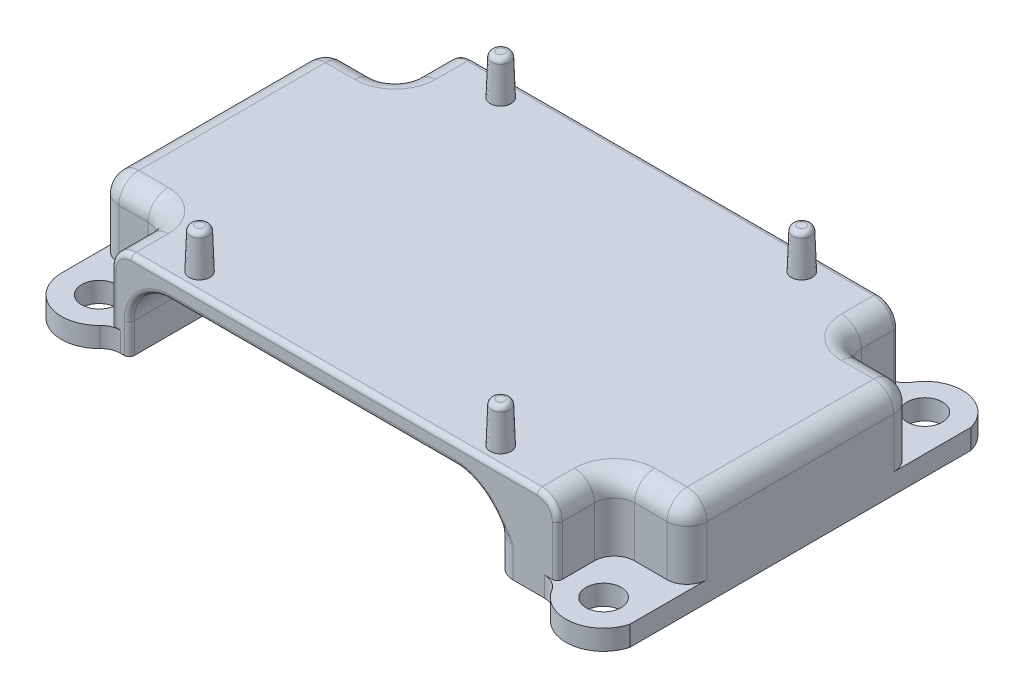
from build123d import *

# Parameters (mm, degrees)
SKETCH1_R             = 1.75
BOSS_EXTRUDE1_DEPTH   = 2
BOSS_EXTRUDE1_2_DEPTH = 2
BOSS_EXTRUDE2_DEPTH   = 7
CUT_EXTRUDE1_REACH    = 68.646
SKETCH4_W             = 36.25
SKETCH4_H             = 7
SKETCH5_R             = 0.9
BOSS_EXTRUDE3_DEPTH   = 4
FILLET1_R             = 2
FILLET2_R             = 4
FILLET3_R             = 0.5
DRAFT4_ANGLE          = 2
FILLET4_R             = 0.5


with BuildPart() as part:
    # Sketch1 → Boss-Extrude1 (new body)
    with BuildSketch(Plane(origin=(0, 0, 0), x_dir=(1, 0, 0), z_dir=(0, 1, 0))):
        with BuildLine():
            Line((-3.75, 30), (-3.75, 0))
            ThreePointArc((-3.75, 0), (-1.040903107, -3.602640798), (3.172144385, -2))
            Line((3.172144385, -2), (5, -2))
            Line((5, -2), (5, 32))
            Line((5, 32), (3.172144385, 32))
            ThreePointArc((3.172144385, 32), (-1.040903107, 33.602640798), (-3.75, 30))
        make_face()
        with Locations(Location((0, 30, 0), (0, 0, 270))):
            Circle(SKETCH1_R, mode=Mode.SUBTRACT)
        with Locations(Location((0, 0, 0), (0, 0, 270))):
            Circle(SKETCH1_R, mode=Mode.SUBTRACT)
    extrude(amount=BOSS_EXTRUDE1_DEPTH)



with BuildPart() as body_2:
    # Sketch1 → Boss-Extrude1 2 (new body)
    with BuildSketch(Plane(origin=(0, 0, 0), x_dir=(1, 0, 0), z_dir=(0, 1, 0))):
        with BuildLine():
            Line((54.864208074, -2), (54.864208074, 32))
            ThreePointArc((54.864208074, 32), (51.25, 34.75), (47.635791926, 32))
            Line((47.635791926, 32), (41.25, 32))
            Line((41.25, 32), (41.25, -2))
            Line((41.25, -2), (47.635791926, -2))
            ThreePointArc((47.635791926, -2), (51.25, -4.75), (54.864208074, -2))
        make_face()
        with Locations(Location((51.25, 31, 0), (0, 0, 270))):
            Circle(SKETCH1_R, mode=Mode.SUBTRACT)
        with Locations(Location((51.25, -1, 0), (0, 0, 270))):
            Circle(SKETCH1_R, mode=Mode.SUBTRACT)
    extrude(amount=BOSS_EXTRUDE1_2_DEPTH)


with BuildPart() as part_1:
    add(part.part)

    add(body_2.part)  # Boss-Extrude2 merges body 2
    # Sketch3 → Boss-Extrude2 (add)
    with BuildSketch(Plane(origin=(0, 2, 0), x_dir=(1, 0, 0), z_dir=(0, 1, 0))):
        Polygon((47.635791926, 32), (3.172144385, 32), (3.172144385, 26.3), (-3.75, 26.3), (-3.75, 3.7), (3.172144385, 3.7), (3.172144385, -2), (47.635791926, -2), (47.635791926, 3.7), (54.864208074, 3.7), (54.864208074, 26.3), (47.635791926, 26.3), align=None)
    extrude(amount=BOSS_EXTRUDE2_DEPTH)

    # Sketch4 → Cut-Extrude1 (cut, up to next)
    with BuildSketch(Plane(origin=(0, 0, -32), x_dir=(-1, 0, 0), z_dir=(0, 0, -1)), mode=Mode.PRIVATE) as cut_extrude1_sk1:
        with Locations((-23.125, 3.5)):
            Rectangle(SKETCH4_W, SKETCH4_H)
    cut_extrude1_tool1 = extrude(cut_extrude1_sk1.sketch, amount=-CUT_EXTRUDE1_REACH, mode=Mode.PRIVATE) & part_1.part
    add(cut_extrude1_tool1.solids().sort_by_distance((23.125, 3.5, -32))[0], mode=Mode.SUBTRACT)

    # Sketch5 → Boss-Extrude3 (add)
    with BuildSketch(Plane(origin=(0, 9, 0), x_dir=(1, 0, 0), z_dir=(0, 1, 0))):
        with Locations(Location((10, 30, 0), (0, 0, 270))):
            Circle(SKETCH5_R)
        with Locations(Location((10, 0, 0), (0, 0, 270))):
            Circle(SKETCH5_R)
        with Locations(Location((40, 0, 0), (0, 0, 270))):
            Circle(SKETCH5_R)
        with Locations(Location((40, 30, 0), (0, 0, 270))):
            Circle(SKETCH5_R)
    extrude(amount=BOSS_EXTRUDE3_DEPTH)

    # Fillet1
    # the kernel refuses this fillet: 2 mm, written as the material it adds along each edge
    with BuildSketch(Plane(origin=(47.635791926, 0, -32), x_dir=(-1, 0, 0), z_dir=(0, 1, 0))) as fillet1_piece_1:
        with BuildLine():
            CenterArc((1.291146144, -2), FILLET1_R, 90, 58.551018611)
            ThreePointArc((-0.415064019, -0.956521739), (-0.17412446, -0.492757426), (0, 0))
            Line((0, 0), (1.291146144, 0))
        make_face()
    extrude(amount=2)
    with BuildSketch(Plane(origin=(47.635791926, 0, 2), x_dir=(-1, 0, 0), z_dir=(0, 1, 0))) as fillet1_piece_2:
        with BuildLine():
            CenterArc((1.291146144, 2), FILLET1_R, 211.448981389, 58.551018611)
            ThreePointArc((-0.415064019, 0.956521739), (-0.17412446, 0.492757426), (0, 0))
            Line((0, 0), (1.291146144, 0))
        make_face()
    extrude(amount=2)
    with BuildSketch(Plane(origin=(3.172144385, 0, 2), x_dir=(-0.6177921091095272, 0, 0.7863414715770763), z_dir=(0, 1, 0))) as fillet1_piece_3:
        with BuildLine():
            CenterArc((0.980508495, 1.989318881), FILLET1_R, 218.155081242, 45.920790152)
            Line((-0.592174448, 0.753734663), (0, 0))
            ThreePointArc((0, 0), (0.387042827, 0.020027098), (0.774085654, 0))
        make_face()
    extrude(amount=2)
    with BuildSketch(Plane(origin=(3.172144385, 0, -32), x_dir=(-0.617792109109531, 0, -0.7863414715770733), z_dir=(0, 1, 0))) as fillet1_piece_4:
        with BuildLine():
            CenterArc((0.980508495, -1.989318881), FILLET1_R, 95.924128606, 45.920790152)
            Line((-0.592174448, -0.753734663), (0, 0))
            ThreePointArc((0, 0), (0.387042827, -0.020027098), (0.774085654, 0))
        make_face()
    extrude(amount=2)
    with BuildSketch(Plane(origin=(3.172144385, 2, -26.3), x_dir=(0, 0, -1), z_dir=(0, 1, 0)), Plane(origin=(3.172144385, 2, -3.7), x_dir=(-1, 0, 0), z_dir=(0, 1, 0))) as fillet1_piece_5:
        with BuildLine():
            CenterArc((FILLET1_R, FILLET1_R), FILLET1_R, 180, 90)
            Line((0, FILLET1_R), (0, 0))
            Line((0, 0), (FILLET1_R, 0))
        make_face()
    extrude(amount=7)
    with BuildSketch(Plane(origin=(47.635791926, 2, -26.3), x_dir=(0, 0, -1), z_dir=(0, 1, 0)), Plane(origin=(47.635791926, 2, -3.7), x_dir=(1, 0, 0), z_dir=(0, 1, 0))) as fillet1_piece_6:
        with BuildLine():
            CenterArc((FILLET1_R, -FILLET1_R), FILLET1_R, 90, 90)
            Line((0, -FILLET1_R), (0, 0))
            Line((0, 0), (FILLET1_R, 0))
        make_face()
    extrude(amount=7)
    # the kernel refuses this fillet: 2 mm, written as the material it takes off along each edge
    with BuildSketch(Plane(origin=(41.25, -5, 2), x_dir=(1, 0, 0), z_dir=(0, 1, 0)), Plane(origin=(-3.75, 2, -26.3), x_dir=(0, 0, 1), z_dir=(0, 1, 0))) as fillet1_2_piece_1:
        with BuildLine():
            CenterArc((FILLET1_R, FILLET1_R), FILLET1_R, 180, 90)
            Line((0, FILLET1_R), (0, 0))
            Line((0, 0), (FILLET1_R, 0))
        make_face()
    extrude(amount=12, mode=Mode.SUBTRACT)
    with BuildSketch(Plane(origin=(41.25, -5, -32), x_dir=(1, 0, 0), z_dir=(0, 1, 0)), Plane(origin=(54.864208074, 2, -3.7), x_dir=(-1, 0, 0), z_dir=(0, 1, 0)), Plane(origin=(54.864208074, 2, -26.3), x_dir=(0, 0, 1), z_dir=(0, 1, 0)), Plane(origin=(-3.75, 2, -3.7), x_dir=(0, 0, -1), z_dir=(0, 1, 0))) as fillet1_2_piece_2:
        with BuildLine():
            CenterArc((FILLET1_R, -FILLET1_R), FILLET1_R, 90, 90)
            Line((0, -FILLET1_R), (0, 0))
            Line((0, 0), (FILLET1_R, 0))
        make_face()
    extrude(amount=12, mode=Mode.SUBTRACT)
    with BuildSketch(Plane(origin=(54.864208074, 9, 1.3), x_dir=(-1, 0, 0), z_dir=(0, 0, -1))) as fillet1_2_piece_3:
        with BuildLine():
            CenterArc((FILLET1_R, -FILLET1_R), FILLET1_R, 90, 90)
            Line((0, -FILLET1_R), (0, 0))
            Line((0, 0), (FILLET1_R, 0))
        make_face()
    extrude(amount=32.6, mode=Mode.SUBTRACT)
    with BuildSketch(Plane(origin=(-3.75, 9, -31.3), x_dir=(0, -1, 0), z_dir=(0, 0, 1))) as fillet1_2_piece_4:
        with BuildLine():
            CenterArc((FILLET1_R, FILLET1_R), FILLET1_R, 180, 90)
            Line((0, FILLET1_R), (0, 0))
            Line((0, 0), (FILLET1_R, 0))
        make_face()
    extrude(amount=32.6, mode=Mode.SUBTRACT)
    # the kernel refuses this fillet: 2 mm, written as the material it takes off along each edge
    with BuildSketch(Plane(origin=(-1.75, 7, -5.7), x_dir=(0, 1, 0), z_dir=(0, 0, 1))) as fillet1_3_piece_1_section:
        Polygon((0, 0), (FILLET1_R * 1.02, 0), (FILLET1_R * 1.02, FILLET1_R * 1.02), (0, FILLET1_R * 1.02), align=None)
    fillet1_3_piece_1 = extrude(amount=FILLET1_R * 1.02, mode=Mode.PRIVATE)
    fillet1_3_piece_1 = fillet1_3_piece_1 - Plane(origin=(-1.75, 7, -5.7), x_dir=(0.7071067811865475, -0.7071067811865475, 0), z_dir=(0, 0, 1)) * Sphere(FILLET1_R, mode=Mode.PRIVATE)
    add(fillet1_3_piece_1, mode=Mode.SUBTRACT)
    with BuildSketch(Plane(origin=(-1.75, 7, -24.3), x_dir=(0, 1, 0), z_dir=(0, 0, -1))) as fillet1_3_piece_2_section:
        Polygon((0, 0), (FILLET1_R * 1.02, 0), (FILLET1_R * 1.02, -FILLET1_R * 1.02), (0, -FILLET1_R * 1.02), align=None)
    fillet1_3_piece_2 = extrude(amount=FILLET1_R * 1.02, mode=Mode.PRIVATE)
    fillet1_3_piece_2 = fillet1_3_piece_2 - Plane(origin=(-1.75, 7, -24.3), x_dir=(0.7071067811865475, -0.7071067811865475, 0), z_dir=(0, 0, -1)) * Sphere(FILLET1_R, mode=Mode.PRIVATE)
    add(fillet1_3_piece_2, mode=Mode.SUBTRACT)
    with BuildSketch(Plane(origin=(52.864208074, 7, -5.7), x_dir=(0, 1, 0), z_dir=(0, 0, 1))) as fillet1_3_piece_3_section:
        Polygon((0, 0), (FILLET1_R * 1.02, 0), (FILLET1_R * 1.02, -FILLET1_R * 1.02), (0, -FILLET1_R * 1.02), align=None)
    fillet1_3_piece_3 = extrude(amount=FILLET1_R * 1.02, mode=Mode.PRIVATE)
    fillet1_3_piece_3 = fillet1_3_piece_3 - Plane(origin=(52.864208074, 7, -5.7), x_dir=(-0.7071067811865475, -0.7071067811865475, 0), z_dir=(0, 0, 1)) * Sphere(FILLET1_R, mode=Mode.PRIVATE)
    add(fillet1_3_piece_3, mode=Mode.SUBTRACT)
    with BuildSketch(Plane(origin=(52.864208074, 7, -24.3), x_dir=(0, 1, 0), z_dir=(0, 0, -1))) as fillet1_3_piece_4_section:
        Polygon((0, 0), (FILLET1_R * 1.02, 0), (FILLET1_R * 1.02, FILLET1_R * 1.02), (0, FILLET1_R * 1.02), align=None)
    fillet1_3_piece_4 = extrude(amount=FILLET1_R * 1.02, mode=Mode.PRIVATE)
    fillet1_3_piece_4 = fillet1_3_piece_4 - Plane(origin=(52.864208074, 7, -24.3), x_dir=(-0.7071067811865475, -0.7071067811865475, 0), z_dir=(0, 0, -1)) * Sphere(FILLET1_R, mode=Mode.PRIVATE)
    add(fillet1_3_piece_4, mode=Mode.SUBTRACT)
    with BuildSketch(Plane(origin=(47.635791926, 9, -28.3), x_dir=(-1, 0, 0), z_dir=(0, 0, -1))) as fillet1_3_piece_5:
        with BuildLine():
            CenterArc((FILLET1_R, -FILLET1_R), FILLET1_R, 90, 90)
            Line((0, -FILLET1_R), (0, 0))
            Line((0, 0), (FILLET1_R, 0))
        make_face()
    extrude(amount=8.7, mode=Mode.SUBTRACT)
    with BuildSketch(Plane(origin=(47.635791926, 9, 7), x_dir=(0, -1, 0), z_dir=(0, 0, -1)), Plane(origin=(3.172144385, 9, -37), x_dir=(0, -1, 0), z_dir=(0, 0, 1)), Plane(origin=(3.172144385, 9, -1.7), x_dir=(0, -1, 0), z_dir=(0, 0, 1))) as fillet1_3_piece_6:
        with BuildLine():
            CenterArc((FILLET1_R, FILLET1_R), FILLET1_R, 180, 90)
            Line((0, FILLET1_R), (0, 0))
            Line((0, 0), (FILLET1_R, 0))
        make_face()
    extrude(amount=8.7, mode=Mode.SUBTRACT)
    with BuildSketch(Plane(origin=(52.864208074, 9, -26.3), x_dir=(0, -1, 0), z_dir=(-1, 0, 0)), Plane(origin=(49.635791926, 9, -3.7), x_dir=(0, -1, 0), z_dir=(1, 0, 0))) as fillet1_3_piece_7:
        with BuildLine():
            CenterArc((FILLET1_R, FILLET1_R), FILLET1_R, 180, 90)
            Line((0, FILLET1_R), (0, 0))
            Line((0, 0), (FILLET1_R, 0))
        make_face()
    extrude(amount=3.228416147, mode=Mode.SUBTRACT)
    with BuildSketch(Plane(origin=(1.172144385, 9, -26.3), x_dir=(0, -1, 0), z_dir=(-1, 0, 0)), Plane(origin=(-1.75, 9, -3.7), x_dir=(0, -1, 0), z_dir=(1, 0, 0))) as fillet1_3_piece_8:
        with BuildLine():
            CenterArc((FILLET1_R, FILLET1_R), FILLET1_R, 180, 90)
            Line((0, FILLET1_R), (0, 0))
            Line((0, 0), (FILLET1_R, 0))
        make_face()
    extrude(amount=2.922144385, mode=Mode.SUBTRACT)
    with BuildSketch(Plane(origin=(1.172144385, 9, -1.7), x_dir=(0, 0, -1), z_dir=(-1, 0, 0))) as fillet1_3_piece_9:
        with BuildLine():
            CenterArc((2 + FILLET1_R, FILLET1_R), FILLET1_R, 180, 90)
            Line((2 + FILLET1_R, 0), (2, 0))
            Line((2, 0), (2, FILLET1_R))
        make_face()
    revolve(axis=Axis((1.172144385, 9, -1.7), (0, -1, 0)), revolution_arc=90, mode=Mode.SUBTRACT)
    with BuildSketch(Plane(origin=(1.172144385, 9, -28.3), x_dir=(1, 0, 0), z_dir=(0, 0, -1))) as fillet1_3_piece_10:
        with BuildLine():
            CenterArc((2 + FILLET1_R, FILLET1_R), FILLET1_R, 180, 90)
            Line((2 + FILLET1_R, 0), (2, 0))
            Line((2, 0), (2, FILLET1_R))
        make_face()
    revolve(axis=Axis((1.172144385, 9, -28.3), (0, -1, 0)), revolution_arc=90, mode=Mode.SUBTRACT)
    with BuildSketch(Plane(origin=(49.635791926, 9, -1.7), x_dir=(0, 0, -1), z_dir=(1, 0, 0))) as fillet1_3_piece_11:
        with BuildLine():
            CenterArc((2 + FILLET1_R, -FILLET1_R), FILLET1_R, 90, 90)
            Line((2 + FILLET1_R, 0), (2, 0))
            Line((2, 0), (2, -FILLET1_R))
        make_face()
    revolve(axis=Axis((49.635791926, 9, -1.7), (0, 1, 0)), revolution_arc=90, mode=Mode.SUBTRACT)
    with BuildSketch(Plane(origin=(49.635791926, 9, -28.3), x_dir=(-1, 0, 0), z_dir=(0, 0, -1))) as fillet1_3_piece_12:
        with BuildLine():
            CenterArc((2 + FILLET1_R, -FILLET1_R), FILLET1_R, 90, 90)
            Line((2 + FILLET1_R, 0), (2, 0))
            Line((2, 0), (2, -FILLET1_R))
        make_face()
    revolve(axis=Axis((49.635791926, 9, -28.3), (0, 1, 0)), revolution_arc=90, mode=Mode.SUBTRACT)

    # Fillet2
    fillet2_edges = [part_1.edges().sort_by_distance(p)[0] for p in [
        (5, 7, -15),
    ]]
    fillet(fillet2_edges, radius=FILLET2_R)
    fillet2_2_edges = [part_1.edges().sort_by_distance(p)[0] for p in [
        (41.835786438, 7, -31.414213562),
        (41.25, 7, -15),
        (41.835786438, 7, 1.414213562),
    ]]
    fillet(fillet2_2_edges, radius=FILLET2_R)

    # Fillet3
    fillet3_edges = [part_1.edges().sort_by_distance(p)[0] for p in [
        (47.635791926, 4.5, -32),
        (25.403968156, 9, -32),
        (25.403968156, 9, 2),
        (3.172144385, 4.5, -32),
        (3.757930823, 8.414213562, -32),
        (47.050005489, 8.414213562, -32),
        (47.635791926, 4.5, 2),
        (3.172144385, 4.5, 2),
        (3.757930823, 8.414213562, 2),
        (47.050005489, 8.414213562, 2),
        (23.296572875, 7, 2),
        (23.296572875, 7, -32),
        (5, 1.5, -32),
        (5, 1.5, 2),
        (40.905038013, 5.735944596, 2),
        (40.905038041, 5.735944573, -32),
        (6.171572875, 5.828427125, -32),
        (6.171572875, 5.828427125, 2),
    ]]
    fillet(fillet3_edges, radius=FILLET3_R)

    # Draft4
    draft4_faces = [part_1.faces().sort_by_distance(p)[0] for p in [
        (10, 11, -0.9),
        (40, 11, -0.9),
        (40, 11, -30.9),
        (10, 11, -30.9),
    ]]
    draft(draft4_faces, Plane(origin=(10, 13, -30), x_dir=(0, 0, 1), z_dir=(0, 1, 0)), DRAFT4_ANGLE)

    # Fillet4
    fillet4_edges = [part_1.edges().sort_by_distance(p)[0] for p in [
        (10, 13, -0.9),
        (40, 13, -0.9),
        (40, 13, -30.9),
        (10, 13, -30.9),
    ]]
    fillet(fillet4_edges, radius=FILLET4_R)


solid = part_1.part
